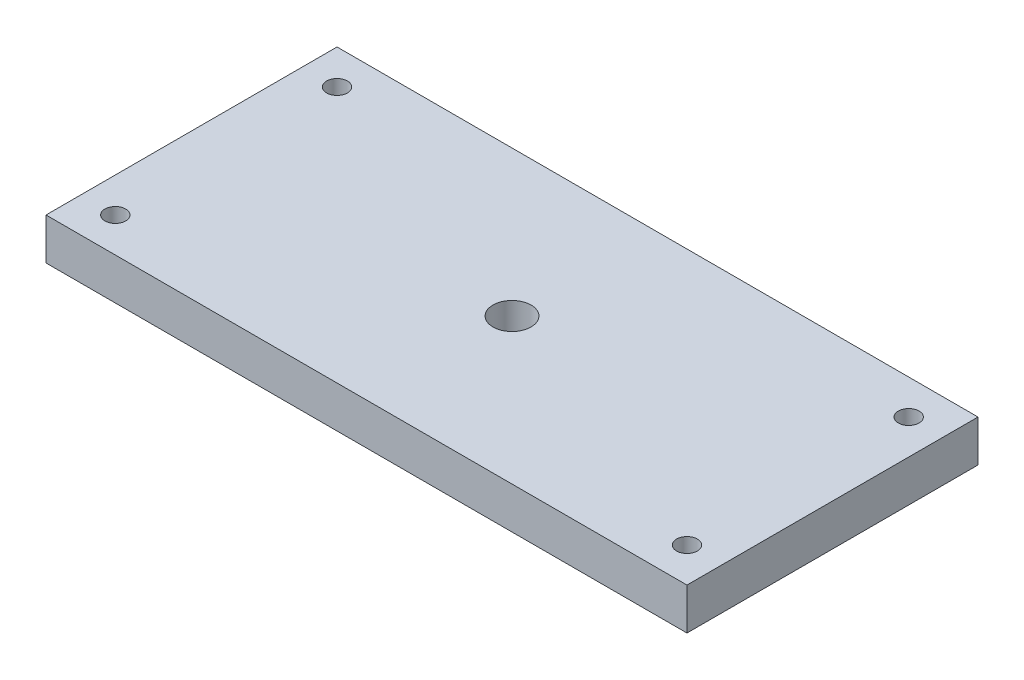
from build123d import *

# Parameters (mm, degrees)
SKETCH2_W           = 92.5
SKETCH2_H           = 42
SKETCH2_R           = 1.5
SKETCH2_R_2         = 2.75
BOSS_EXTRUDE1_DEPTH = 6


with BuildPart() as part:
    # Sketch2 → Boss-Extrude1 (new body)
    with BuildSketch(Plane(origin=(0, 0, 0), x_dir=(1, 0, 0), z_dir=(0, 1, 0))):
        with Locations((20.253338886, 13.715343577)):
            Rectangle(SKETCH2_W, SKETCH2_H)
        with Locations((-20.996661114, 29.715343577)):
            Circle(SKETCH2_R, mode=Mode.SUBTRACT)
        with Locations((-20.996661114, -2.284656423)):
            Circle(SKETCH2_R, mode=Mode.SUBTRACT)
        with Locations((61.503338886, -2.284656423)):
            Circle(SKETCH2_R, mode=Mode.SUBTRACT)
        with Locations((61.503338886, 29.715343577)):
            Circle(SKETCH2_R, mode=Mode.SUBTRACT)
        with Locations((20.253338886, 13.715343577)):
            Circle(SKETCH2_R_2, mode=Mode.SUBTRACT)
    extrude(amount=BOSS_EXTRUDE1_DEPTH)


solid = part.part
